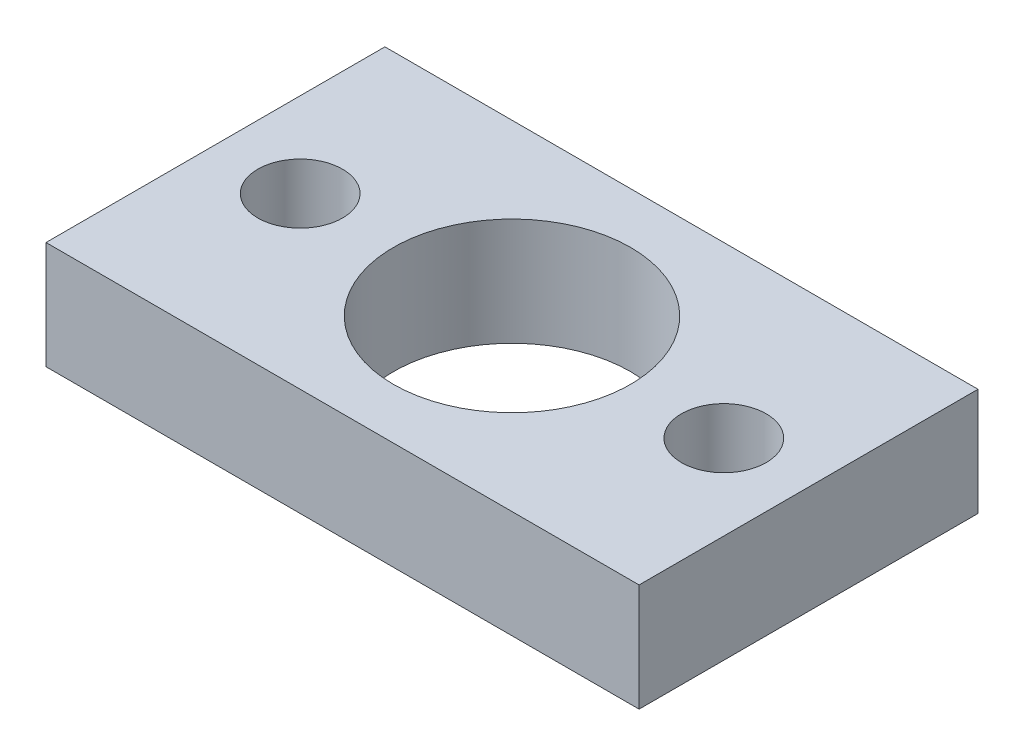
from build123d import *

# Parameters (mm, degrees)
SKETCH1_W           = 35
SKETCH1_H           = 20
SKETCH1_R           = 7
SKETCH1_R_2         = 2.5
BOSS_EXTRUDE1_DEPTH = 3.175


with BuildPart() as part:
    # Sketch1 → Boss-Extrude1 (new, symmetric)
    with BuildSketch(Plane(origin=(0, 0, 0), x_dir=(1, 0, 0), z_dir=(0, 1, 0))):
        Rectangle(SKETCH1_W, SKETCH1_H)
        Circle(SKETCH1_R, mode=Mode.SUBTRACT)
        with Locations((12.5, 0)):
            Circle(SKETCH1_R_2, mode=Mode.SUBTRACT)
        with Locations((-12.5, 0)):
            Circle(SKETCH1_R_2, mode=Mode.SUBTRACT)
    extrude(amount=BOSS_EXTRUDE1_DEPTH, both=True)


solid = part.part
